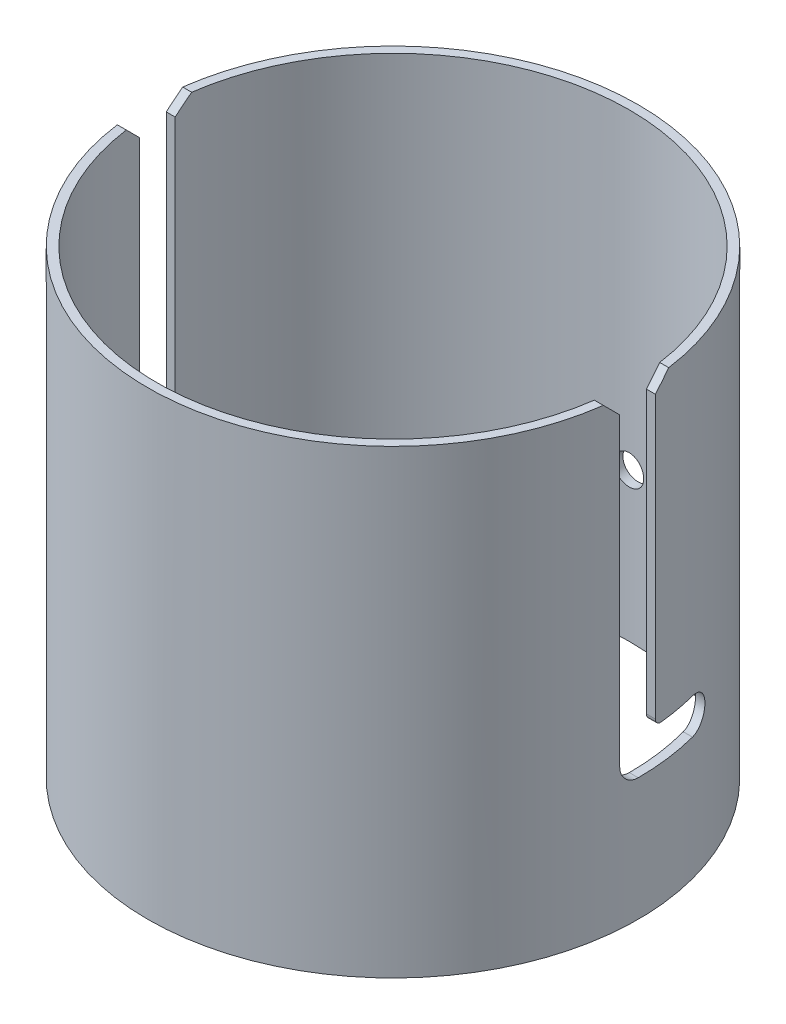
from build123d import *

# Parameters (mm, degrees)
SKETCH2_W                    = 3
SKETCH2_H                    = 155
CUT_EXTRUDE1_DEPTH           = 195.046399091
FILLET1_R                    = 6
CHAMFER1_SIZE                = 5
FILLET4_R                    = 2
CIRPATTERN1_COUNT            = 2
FILLET1_OF_CIRPATTERN1_R     = 6
CHAMFER1_OF_CIRPATTERN1_SIZE = 5
FILLET4_OF_CIRPATTERN1_R     = 2
SKETCH4_R                    = 5
CUT_EXTRUDE2_DEPTH           = 100


with BuildPart() as part:
    # Sketch2 → Revolve1 (revolve)
    with BuildSketch(Plane(origin=(0, 0, 0), x_dir=(0, 0, -1), z_dir=(1, 0, 0))):
        with Locations((-81.05, 77.5)):
            Rectangle(SKETCH2_W, SKETCH2_H)
    revolve(axis=Axis((0, -7.75, 0), (0, 1, 0)))

    # Sketch3 → Cut-Extrude1 (cut, through all)
    with BuildSketch(Plane(origin=(0, 0, 0), x_dir=(0, 0, -1), z_dir=(1, 0, 0))):
        with BuildLine():
            Line((-6, 155), (6, 155))
            Line((6, 155), (6, 41.3))
            Line((6, 41.3), (-21, 41.3))
            ThreePointArc((-21, 41.3), (-27, 47.3), (-21, 53.3))
            Line((-21, 53.3), (-6, 53.3))
            Line((-6, 53.3), (-6, 155))
        make_face()
    cut_extrude1 = extrude(amount=-CUT_EXTRUDE1_DEPTH, mode=Mode.SUBTRACT)

    # Fillet1
    fillet1_edges = [part.edges().sort_by_distance(p)[0] for p in [
        (-80.82753304, 41.3, -6),
    ]]
    fillet(fillet1_edges, radius=FILLET1_R)

    # Chamfer1
    chamfer1_edges = [part.edges().sort_by_distance(p)[0] for p in [
        (-80.82753304, 155, 6),
        (-80.82753304, 155, -6),
    ]]
    chamfer(chamfer1_edges, length=CHAMFER1_SIZE)

    # Fillet4
    fillet4_edges = [part.edges().sort_by_distance(p)[0] for p in [
        (-80.82753304, 53.3, 6),
    ]]
    fillet(fillet4_edges, radius=FILLET4_R)

    # CirPattern1: Cut-Extrude1 ×2 about axis
    cirpattern1_axis = Axis((0, -7.75, 0), (0, 1, 0))
    for i in range(1, CIRPATTERN1_COUNT):
        add(cut_extrude1.rotate(cirpattern1_axis, i * 360 / CIRPATTERN1_COUNT), mode=Mode.SUBTRACT)

    # Fillet1 of CirPattern1
    fillet1_of_cirpattern1_edges = [part.edges().sort_by_distance(p)[0] for p in [
        (80.82753304, 41.3, 6),
    ]]
    fillet(fillet1_of_cirpattern1_edges, radius=FILLET1_OF_CIRPATTERN1_R)

    # Chamfer1 of CirPattern1
    chamfer1_of_cirpattern1_edges = [part.edges().sort_by_distance(p)[0] for p in [
        (80.82753304, 155, -6),
        (80.82753304, 155, 6),
    ]]
    chamfer(chamfer1_of_cirpattern1_edges, length=CHAMFER1_OF_CIRPATTERN1_SIZE)

    # Fillet4 of CirPattern1
    fillet4_of_cirpattern1_edges = [part.edges().sort_by_distance(p)[0] for p in [
        (80.82753304, 53.3, -6),
    ]]
    fillet(fillet4_of_cirpattern1_edges, radius=FILLET4_OF_CIRPATTERN1_R)

    # Sketch4 → Cut-Extrude2 (cut)
    with BuildSketch(Plane.XY):
        with Locations((0, 50)):
            Circle(SKETCH4_R)
    extrude(amount=-CUT_EXTRUDE2_DEPTH, mode=Mode.SUBTRACT)


solid = part.part
